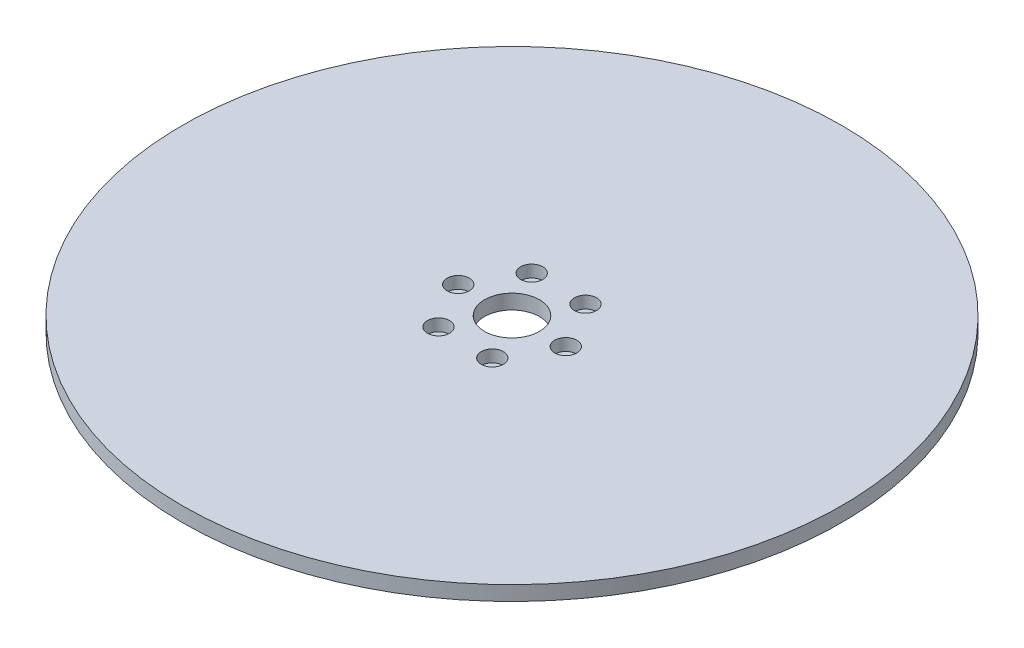
from build123d import *

# Parameters (mm, degrees)
SKETCH1_R           = 90
BOSS_EXTRUDE1_DEPTH = 4
SKETCH2_R           = 7.5
CUT_EXTRUDE1_DEPTH  = 128.342059038
SKETCH3_R           = 3.023767703
CUT_EXTRUDE2_DEPTH  = 3.297005777
CIRPATTERN1_COUNT   = 6


with BuildPart() as part:
    # Sketch1 → Boss-Extrude1 (new body)
    with BuildSketch(Plane(origin=(0, 0, 0), x_dir=(1, 0, 0), z_dir=(0, 1, 0))):
        Circle(SKETCH1_R)
    extrude(amount=BOSS_EXTRUDE1_DEPTH)

    # Sketch2 → Cut-Extrude1 (cut, through all)
    with BuildSketch(Plane(origin=(0, 0, 0), x_dir=(1, 0, 0), z_dir=(0, 1, 0))):
        Circle(SKETCH2_R)
    extrude(amount=CUT_EXTRUDE1_DEPTH, mode=Mode.SUBTRACT)

    # Sketch3 → Cut-Extrude2 (cut)
    with BuildSketch(Plane(origin=(0, 4, 0), x_dir=(1, 0, 0), z_dir=(0, 1, 0))):
        with Locations((-14.689580211, 0)):
            Circle(SKETCH3_R)
    cut_extrude2 = extrude(amount=-CUT_EXTRUDE2_DEPTH, mode=Mode.SUBTRACT)

    # CirPattern1: Cut-Extrude2 ×6 about axis
    cirpattern1_axis = Axis((0, 0, 0), (0, 1, 0))
    for i in range(1, CIRPATTERN1_COUNT):
        add(cut_extrude2.rotate(cirpattern1_axis, i * 360 / CIRPATTERN1_COUNT), mode=Mode.SUBTRACT)


solid = part.part
